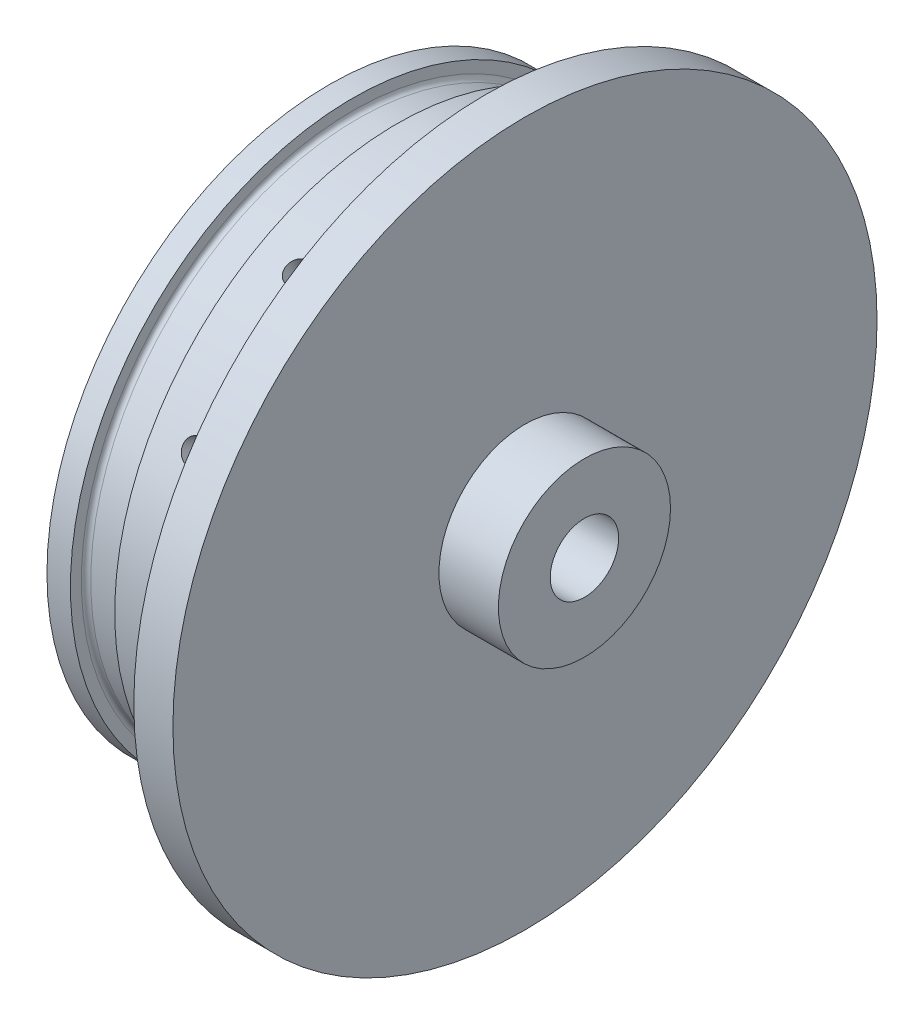
from build123d import *

# Parameters (mm, degrees)
SKETCH1_R               = 57.15
BOSS_EXTRUDE1_DEPTH     = 6.35
SKETCH2_R               = 45.847
BOSS_EXTRUDE2_DEPTH     = 25.4
SKETCH11_R              = 1.89865
CUT_EXTRUDE3_DEPTH      = 10.16
CIRPATTERN1_COUNT       = 12
CUT_EXTRUDE4_DEPTH      = 87.83494404
CUT_EXTRUDE4_DEPTH_BACK = 87.83494404
SKETCH15_R              = 5.55625
BOSS_EXTRUDE3_START     = 9.652
SKETCH17_R              = 13.97
SKETCH17_R_2            = 5.55625
BOSS_EXTRUDE3_DEPTH     = 9.652
SKETCH18_R              = 38.354
CUT_EXTRUDE5_DEPTH      = 6.604
SKETCH19_R              = 1.1303
CUT_EXTRUDE6_DEPTH      = 6.35


with BuildPart() as part:
    # Sketch1 → Boss-Extrude1 (new body)
    with BuildSketch(Plane(origin=(0, 0, 0), x_dir=(0, 0, -1), z_dir=(1, 0, 0))):
        Circle(SKETCH1_R)
    extrude(amount=BOSS_EXTRUDE1_DEPTH)

    # Sketch2 → Boss-Extrude2 (add)
    with BuildSketch(Plane.ZY):
        Circle(SKETCH2_R)
    extrude(amount=BOSS_EXTRUDE2_DEPTH)

    # Sketch11 → Cut-Extrude3 (cut)
    with BuildSketch(Plane(origin=(0, 0, -45.847), x_dir=(-1, 0, 0), z_dir=(0, 0, -1))):
        with Locations((7.62, 0)):
            Circle(SKETCH11_R)
    cut_extrude3 = extrude(amount=-CUT_EXTRUDE3_DEPTH, mode=Mode.SUBTRACT)

    # CirPattern1: Cut-Extrude3 ×12 about axis
    cirpattern1_axis = Axis((0, 0, 0), (-1, 0, 0))
    for i in range(1, CIRPATTERN1_COUNT):
        add(cut_extrude3.rotate(cirpattern1_axis, i * 360 / CIRPATTERN1_COUNT), mode=Mode.SUBTRACT)

    # Sketch15 → Cut-Extrude4 (cut, two sides: drawn at the far end of the back side and taken through both)
    with BuildSketch(Plane(origin=(6.35, 0, 0), x_dir=(0, 0, -1), z_dir=(1, 0, 0)).offset(-CUT_EXTRUDE4_DEPTH_BACK)):
        Circle(SKETCH15_R)
    extrude(amount=CUT_EXTRUDE4_DEPTH + CUT_EXTRUDE4_DEPTH_BACK, mode=Mode.SUBTRACT)

    # Sketch16 → Cut-Revolve1 (revolve, cut)
    with BuildSketch(Plane.XY):
        with BuildLine():
            Line((-21.59, 45.847), (-14.4018, 45.847))
            Line((-14.4018, 45.847), (-14.4018, 44.069))
            ThreePointArc((-14.4018, 44.069), (-14.624984633, 43.530184633), (-15.1638, 43.307))
            Line((-15.1638, 43.307), (-20.828, 43.307))
            ThreePointArc((-20.828, 43.307), (-21.366815367, 43.530184633), (-21.59, 44.069))
            Line((-21.59, 44.069), (-21.59, 45.847))
        make_face()
    revolve(axis=Axis((0, 0, 0), (-1, 0, 0)), mode=Mode.SUBTRACT)

    # Sketch17 → Boss-Extrude3 (add)
    with BuildSketch(Plane(origin=(6.35, 0, 0), x_dir=(0, 0, -1), z_dir=(1, 0, 0)).offset(BOSS_EXTRUDE3_START)):
        Circle(SKETCH17_R)
        Circle(SKETCH17_R_2, mode=Mode.SUBTRACT)
    extrude(amount=-BOSS_EXTRUDE3_DEPTH)

    # Sketch18 → Cut-Extrude5 (cut)
    with BuildSketch(Plane.ZY.offset(25.4)):
        Circle(SKETCH18_R)
    extrude(amount=-CUT_EXTRUDE5_DEPTH, mode=Mode.SUBTRACT)

    # Sketch19 → Cut-Extrude6 (cut)
    with BuildSketch(Plane.ZY.offset(18.796)):
        with Locations((0, 33.3375)):
            Circle(SKETCH19_R)
        with Locations((23.573172318, 23.573172318)):
            Circle(SKETCH19_R)
        with Locations((33.3375, 0)):
            Circle(SKETCH19_R)
        with Locations((23.573172318, -23.573172318)):
            Circle(SKETCH19_R)
        with Locations((0, -33.3375)):
            Circle(SKETCH19_R)
        with Locations((-23.573172318, -23.573172318)):
            Circle(SKETCH19_R)
        with Locations((-33.3375, 0)):
            Circle(SKETCH19_R)
        with Locations((-23.573172318, 23.573172318)):
            Circle(SKETCH19_R)
    extrude(amount=-CUT_EXTRUDE6_DEPTH, mode=Mode.SUBTRACT)

    # Sketch20 → Cut-Revolve2 (revolve, cut)
    with BuildSketch(Plane.XY):
        Polygon((0, 0), (-18.796, 0), (-18.796, 27.94), (0, 15.875), align=None)
    revolve(axis=Axis((0, 0, 0), (-1, 0, 0)), mode=Mode.SUBTRACT)


solid = part.part
